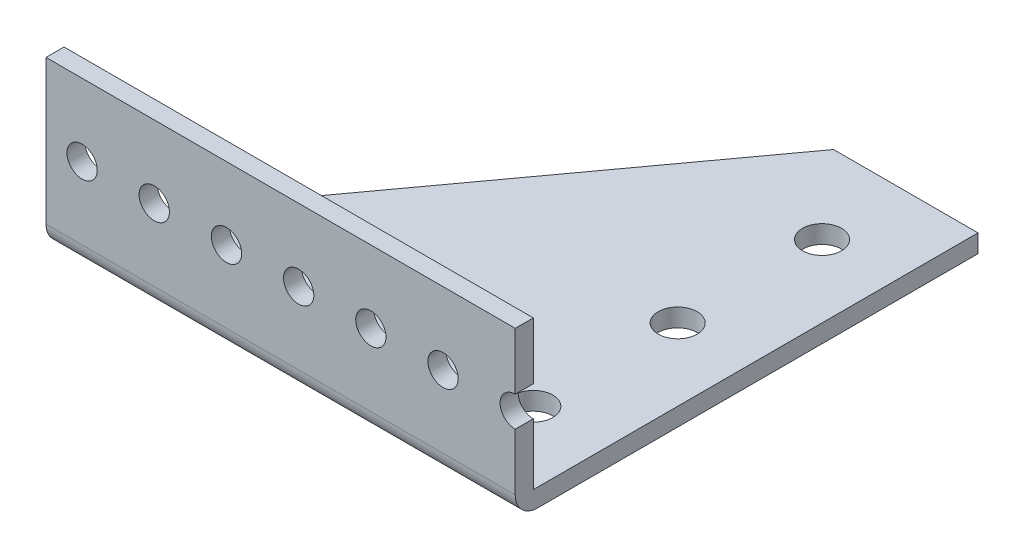
from build123d import *

# Parameters (mm, degrees)
BOSS_EXTRUDE1_START    = -34.925
SKETCH1_W              = 82.55
SKETCH1_H              = 81.407
BOSS_EXTRUDE1_DEPTH    = 3.175
SKETCH3_W              = 82.55
SKETCH3_H              = 3.175
BOSS_EXTRUDE2_DEPTH    = 50.8
F_10_CLEARANCE_HOLE2_D = 5.334
CHAMFER1_SIZE          = 3.175
FILLET2_R              = 3.937
SKETCH9_R              = 3.429
CUT_EXTRUDE2_DEPTH     = 80.206698973
SKETCH10_W             = 82.55
SKETCH10_H             = 24.638
CUT_EXTRUDE3_DEPTH     = 98.726561891


with BuildPart() as part:
    # Sketch1 → Boss-Extrude1 (new body)
    with BuildSketch(Plane(origin=(0, 0, 0), x_dir=(1, 0, 0), z_dir=(0, 1, 0)).offset(BOSS_EXTRUDE1_START)):
        Rectangle(SKETCH1_W, SKETCH1_H)
    extrude(amount=BOSS_EXTRUDE1_DEPTH)

    # Sketch3 → Boss-Extrude2 (add)
    with BuildSketch(Plane(origin=(0, -31.75, 0), x_dir=(1, 0, 0), z_dir=(0, 1, 0))):
        with Locations((0, -39.116)):
            Rectangle(SKETCH3_W, SKETCH3_H)
    extrude(amount=BOSS_EXTRUDE2_DEPTH)

    # #10 Clearance Hole2 (through all)
    with Locations(Plane(origin=(0, 0, -40.7035), x_dir=(-1, 0, 0), z_dir=(0, 0, -1))):
        with Locations((22.225, 7.112), (9.525, 7.112), (-3.175, 7.112), (-15.875, 7.112), (-28.575, 7.112), (22.225, -18.288), (9.525, -18.288), (-3.175, -18.288), (-15.875, -18.288), (-28.575, -18.288), (34.925, 7.112), (34.925, -18.288), (-41.275, 7.112), (-41.275, -18.288)):
            Hole(F_10_CLEARANCE_HOLE2_D / 2)

    # Chamfer1
    chamfer1_edges = [part.edges().sort_by_distance(p)[0] for p in [
        (-41.275, 19.05, 39.116),
    ]]
    chamfer(chamfer1_edges, length=CHAMFER1_SIZE)

    # Fillet2
    fillet2_edges = [part.edges().sort_by_distance(p)[0] for p in [
        (0, -34.925, 40.7035),
    ]]
    fillet(fillet2_edges, radius=FILLET2_R)

    # Sketch9 → Cut-Extrude2 (cut, through all)
    with BuildSketch(Plane.XZ.offset(34.925)):
        with Locations((28.575, 24.8285)):
            Circle(SKETCH9_R)
        with Locations((28.575, -0.5715)):
            Circle(SKETCH9_R)
        with Locations((28.575, -25.9715)):
            Circle(SKETCH9_R)
        Polygon((-41.275, 37.5285), (15.875, -40.7035), (-41.275, -40.7035), align=None)
    extrude(amount=-CUT_EXTRUDE2_DEPTH, mode=Mode.SUBTRACT)

    # Sketch10 → Cut-Extrude3 (cut, through all)
    with BuildSketch(Plane.XY.offset(40.7035)):
        with Locations((0, 6.731)):
            Rectangle(SKETCH10_W, SKETCH10_H)
    extrude(amount=-CUT_EXTRUDE3_DEPTH, mode=Mode.SUBTRACT)


solid = part.part
